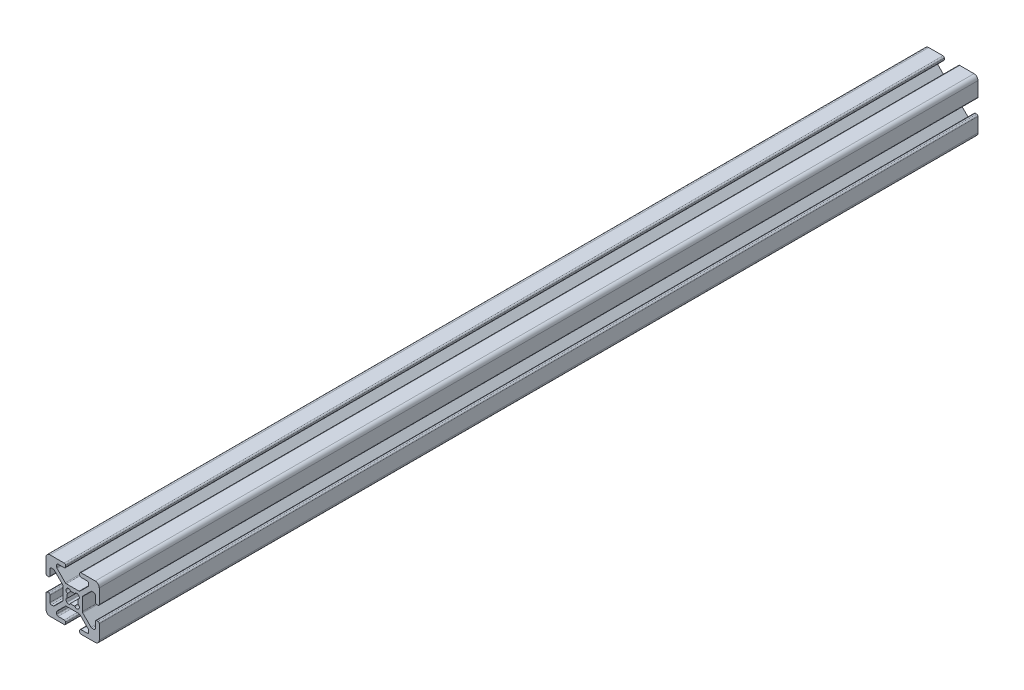
from build123d import *

# Parameters (mm, degrees)
EXTRUDE1_DEPTH = 330


with BuildPart() as part:
    # Sketch1 → Extrude1 (new body)
    with BuildSketch(Plane.XY):
        with BuildLine():
            Line((9.492, 2.63), (9.008, 2.63))
            ThreePointArc((9.008, 2.63), (8.648789755, 2.778789755), (8.5, 3.138))
            Line((8.5, 3.138), (8.5, 5.487))
            ThreePointArc((8.5, 5.487), (8.351210245, 5.846210245), (7.992, 5.995))
            Line((7.992, 5.995), (7.266080661, 5.995))
            ThreePointArc((7.266080661, 5.995), (7.071677478, 5.956330803), (6.906870417, 5.846210245))
            Line((6.906870417, 5.846210245), (3.803789755, 2.743129583))
            ThreePointArc((3.803789755, 2.743129583), (3.693669197, 2.578322522), (3.655, 2.383919339))
            Line((3.655, 2.383919339), (3.655, -2.383919339))
            ThreePointArc((3.655, -2.383919339), (3.693669197, -2.578322522), (3.803789755, -2.743129583))
            Line((3.803789755, -2.743129583), (6.906870417, -5.846210245))
            ThreePointArc((6.906870417, -5.846210245), (7.071677478, -5.956330803), (7.266080661, -5.995))
            Line((7.266080661, -5.995), (7.992, -5.995))
            ThreePointArc((7.992, -5.995), (8.351210245, -5.846210245), (8.5, -5.487))
            Line((8.5, -5.487), (8.5, -3.138))
            ThreePointArc((8.5, -3.138), (8.648789755, -2.778789755), (9.008, -2.63))
            Line((9.008, -2.63), (9.492, -2.63))
            ThreePointArc((9.492, -2.63), (9.851210245, -2.778789755), (10, -3.138))
            Line((10, -3.138), (10, -8.5))
            ThreePointArc((10, -8.5), (9.560660172, -9.560660172), (8.5, -10))
            Line((8.5, -10), (3.138, -10))
            ThreePointArc((3.138, -10), (2.778789755, -9.851210245), (2.63, -9.492))
            Line((2.63, -9.492), (2.63, -9.008))
            ThreePointArc((2.63, -9.008), (2.778789755, -8.648789755), (3.138, -8.5))
            Line((3.138, -8.5), (5.487, -8.5))
            ThreePointArc((5.487, -8.5), (5.846210245, -8.351210245), (5.995, -7.992))
            Line((5.995, -7.992), (5.995, -7.266080661))
            ThreePointArc((5.995, -7.266080661), (5.956330803, -7.071677478), (5.846210245, -6.906870417))
            Line((5.846210245, -6.906870417), (2.743129583, -3.803789755))
            ThreePointArc((2.743129583, -3.803789755), (2.578322522, -3.693669197), (2.383919339, -3.655))
            Line((2.383919339, -3.655), (-2.383919339, -3.655))
            ThreePointArc((-2.383919339, -3.655), (-2.578322522, -3.693669197), (-2.743129583, -3.803789755))
            Line((-2.743129583, -3.803789755), (-5.846210245, -6.906870417))
            ThreePointArc((-5.846210245, -6.906870417), (-5.956330803, -7.071677478), (-5.995, -7.266080661))
            Line((-5.995, -7.266080661), (-5.995, -7.992))
            ThreePointArc((-5.995, -7.992), (-5.846210245, -8.351210245), (-5.487, -8.5))
            Line((-5.487, -8.5), (-3.138, -8.5))
            ThreePointArc((-3.138, -8.5), (-2.778789755, -8.648789755), (-2.63, -9.008))
            Line((-2.63, -9.008), (-2.63, -9.492))
            ThreePointArc((-2.63, -9.492), (-2.778789755, -9.851210245), (-3.138, -10))
            Line((-3.138, -10), (-8.5, -10))
            ThreePointArc((-8.5, -10), (-9.560660172, -9.560660172), (-10, -8.5))
            Line((-10, -8.5), (-10, -3.138))
            ThreePointArc((-10, -3.138), (-9.851210245, -2.778789755), (-9.492, -2.63))
            Line((-9.492, -2.63), (-9.008, -2.63))
            ThreePointArc((-9.008, -2.63), (-8.648789755, -2.778789755), (-8.5, -3.138))
            Line((-8.5, -3.138), (-8.5, -5.487))
            ThreePointArc((-8.5, -5.487), (-8.351210245, -5.846210245), (-7.992, -5.995))
            Line((-7.992, -5.995), (-7.266080661, -5.995))
            ThreePointArc((-7.266080661, -5.995), (-7.071677478, -5.956330803), (-6.906870417, -5.846210245))
            Line((-6.906870417, -5.846210245), (-3.803789755, -2.743129583))
            ThreePointArc((-3.803789755, -2.743129583), (-3.693669197, -2.578322522), (-3.655, -2.383919339))
            Line((-3.655, -2.383919339), (-3.655, 2.383919339))
            ThreePointArc((-3.655, 2.383919339), (-3.693669197, 2.578322522), (-3.803789755, 2.743129583))
            Line((-3.803789755, 2.743129583), (-6.906870417, 5.846210245))
            ThreePointArc((-6.906870417, 5.846210245), (-7.071677478, 5.956330803), (-7.266080661, 5.995))
            Line((-7.266080661, 5.995), (-7.992, 5.995))
            ThreePointArc((-7.992, 5.995), (-8.351210245, 5.846210245), (-8.5, 5.487))
            Line((-8.5, 5.487), (-8.5, 3.138))
            ThreePointArc((-8.5, 3.138), (-8.648789755, 2.778789755), (-9.008, 2.63))
            Line((-9.008, 2.63), (-9.492, 2.63))
            ThreePointArc((-9.492, 2.63), (-9.851210245, 2.778789755), (-10, 3.138))
            Line((-10, 3.138), (-10, 8.5))
            ThreePointArc((-10, 8.5), (-9.560660172, 9.560660172), (-8.5, 10))
            Line((-8.5, 10), (-3.138, 10))
            ThreePointArc((-3.138, 10), (-2.778789755, 9.851210245), (-2.63, 9.492))
            Line((-2.63, 9.492), (-2.63, 9.008))
            ThreePointArc((-2.63, 9.008), (-2.778789755, 8.648789755), (-3.138, 8.5))
            Line((-3.138, 8.5), (-5.487, 8.5))
            ThreePointArc((-5.487, 8.5), (-5.846210245, 8.351210245), (-5.995, 7.992))
            Line((-5.995, 7.992), (-5.995, 7.266080661))
            ThreePointArc((-5.995, 7.266080661), (-5.956330803, 7.071677478), (-5.846210245, 6.906870417))
            Line((-5.846210245, 6.906870417), (-2.743129583, 3.803789755))
            ThreePointArc((-2.743129583, 3.803789755), (-2.578322522, 3.693669197), (-2.383919339, 3.655))
            Line((-2.383919339, 3.655), (2.383919339, 3.655))
            ThreePointArc((2.383919339, 3.655), (2.578322522, 3.693669197), (2.743129583, 3.803789755))
            Line((2.743129583, 3.803789755), (5.846210245, 6.906870417))
            ThreePointArc((5.846210245, 6.906870417), (5.956330803, 7.071677478), (5.995, 7.266080661))
            Line((5.995, 7.266080661), (5.995, 7.992))
            ThreePointArc((5.995, 7.992), (5.846210245, 8.351210245), (5.487, 8.5))
            Line((5.487, 8.5), (3.138, 8.5))
            ThreePointArc((3.138, 8.5), (2.778789755, 8.648789755), (2.63, 9.008))
            Line((2.63, 9.008), (2.63, 9.492))
            ThreePointArc((2.63, 9.492), (2.778789755, 9.851210245), (3.138, 10))
            Line((3.138, 10), (8.5, 10))
            ThreePointArc((8.5, 10), (9.560660172, 9.560660172), (10, 8.5))
            Line((10, 8.5), (10, 3.138))
            ThreePointArc((10, 3.138), (9.851210245, 2.778789755), (9.492, 2.63))
        make_face()
        with BuildLine():
            Line((2.124900844, -2.304505966), (2.304505966, -2.124900844))
            ThreePointArc((2.304505966, -2.124900844), (2.505938017, -1.356467811), (1.935133506, -0.803976718))
            ThreePointArc((1.935133506, -0.803976718), (2.0955, 0), (1.935133506, 0.803976718))
            ThreePointArc((1.935133506, 0.803976718), (2.505938017, 1.356467811), (2.304505966, 2.124900844))
            Line((2.304505966, 2.124900844), (2.124900844, 2.304505966))
            ThreePointArc((2.124900844, 2.304505966), (1.356467811, 2.505938017), (0.803976718, 1.935133506))
            ThreePointArc((0.803976718, 1.935133506), (0, 2.0955), (-0.803976718, 1.935133506))
            ThreePointArc((-0.803976718, 1.935133506), (-1.356467811, 2.505938017), (-2.124900844, 2.304505966))
            Line((-2.124900844, 2.304505966), (-2.304505966, 2.124900844))
            ThreePointArc((-2.304505966, 2.124900844), (-2.505938017, 1.356467811), (-1.935133506, 0.803976718))
            ThreePointArc((-1.935133506, 0.803976718), (-2.0955, 0), (-1.935133506, -0.803976718))
            ThreePointArc((-1.935133506, -0.803976718), (-2.505938017, -1.356467811), (-2.304505966, -2.124900844))
            Line((-2.304505966, -2.124900844), (-2.124900844, -2.304505966))
            ThreePointArc((-2.124900844, -2.304505966), (-1.356467811, -2.505938017), (-0.803976718, -1.935133506))
            ThreePointArc((-0.803976718, -1.935133506), (0, -2.0955), (0.803976718, -1.935133506))
            ThreePointArc((0.803976718, -1.935133506), (1.356467811, -2.505938017), (2.124900844, -2.304505966))
        make_face(mode=Mode.SUBTRACT)
    extrude(amount=-EXTRUDE1_DEPTH)


solid = part.part
